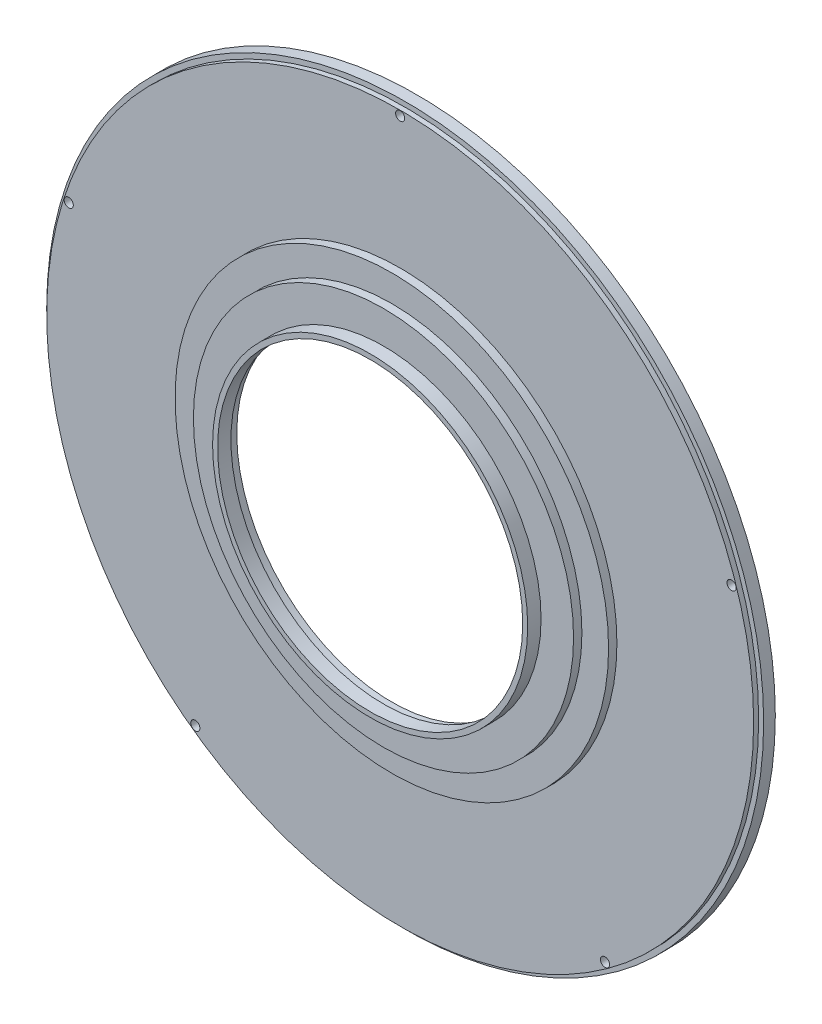
from build123d import *

# Parameters (mm, degrees)
SKETCH1_R           = 215
SKETCH1_R_2         = 120
PLATE_DEPTH         = 10
SKETCH2_R           = 130
SKETCH2_R_2         = 111
BELLMOUTH1_DEPTH    = 5
SKETCH3_R           = 114
SKETCH3_R_2         = 93
BELLMOUTH2_DEPTH    = 5
SKETCH4_R           = 94.5
SKETCH4_R_2         = 91.5
BELLMOUTH3_DEPTH    = 8
SKETCH5_R           = 204
SKETCH5_R_2         = 144
COMB_GROOVE_DEPTH   = 4
SKETCH6_R           = 216
SKETCH6_R_2         = 212
BAND_RABBET_DEPTH   = 3
SKETCH7_R           = 2.75
ROD_HOLES_DEPTH     = 10
SKETCH8_R           = 1.25
SPIDER_SCREWS_DEPTH = 8


with BuildPart() as part:
    # Sketch1 → Plate (new body)
    with BuildSketch(Plane.XY):
        Circle(SKETCH1_R)
        Circle(SKETCH1_R_2, mode=Mode.SUBTRACT)
    extrude(amount=PLATE_DEPTH)

    # Sketch2 → Bellmouth1 (add)
    with BuildSketch(Plane.XY.offset(10)):
        Circle(SKETCH2_R)
        Circle(SKETCH2_R_2, mode=Mode.SUBTRACT)
    extrude(amount=BELLMOUTH1_DEPTH)

    # Sketch3 → Bellmouth2 (add)
    with BuildSketch(Plane.XY.offset(15)):
        Circle(SKETCH3_R)
        Circle(SKETCH3_R_2, mode=Mode.SUBTRACT)
    extrude(amount=BELLMOUTH2_DEPTH)

    # Sketch4 → Bellmouth3 (add)
    with BuildSketch(Plane.XY.offset(20)):
        Circle(SKETCH4_R)
        Circle(SKETCH4_R_2, mode=Mode.SUBTRACT)
    extrude(amount=BELLMOUTH3_DEPTH)

    # Sketch5 → Comb_groove (cut)
    with BuildSketch(Plane.XY):
        Circle(SKETCH5_R)
        Circle(SKETCH5_R_2, mode=Mode.SUBTRACT)
    extrude(amount=COMB_GROOVE_DEPTH, mode=Mode.SUBTRACT)

    # Sketch6 → Band_rabbet (cut)
    with BuildSketch(Plane.XY.offset(7)):
        Circle(SKETCH6_R)
        Circle(SKETCH6_R_2, mode=Mode.SUBTRACT)
    extrude(amount=BAND_RABBET_DEPTH, mode=Mode.SUBTRACT)

    # Sketch7 → Rod_holes (cut)
    with BuildSketch(Plane.XY):
        with Locations((198.770811906, 64.584551824)):
            Circle(SKETCH7_R)
        with Locations((0, 209)):
            Circle(SKETCH7_R)
        with Locations((-198.770811906, 64.584551824)):
            Circle(SKETCH7_R)
        with Locations((-122.847117729, -169.084551824)):
            Circle(SKETCH7_R)
        with Locations((122.847117729, -169.084551824)):
            Circle(SKETCH7_R)
    extrude(amount=ROD_HOLES_DEPTH, mode=Mode.SUBTRACT)

    # Sketch8 → Spider_screws (cut)
    with BuildSketch(Plane.XY):
        with Locations((77.881545929, 107.194751755)):
            Circle(SKETCH8_R)
        with Locations((-77.881545929, 107.194751755)):
            Circle(SKETCH8_R)
        with Locations((-126.014988409, -40.944751755)):
            Circle(SKETCH8_R)
        with Locations((0, -132.5)):
            Circle(SKETCH8_R)
        with Locations((126.014988409, -40.944751755)):
            Circle(SKETCH8_R)
    extrude(amount=SPIDER_SCREWS_DEPTH, mode=Mode.SUBTRACT)


solid = part.part
